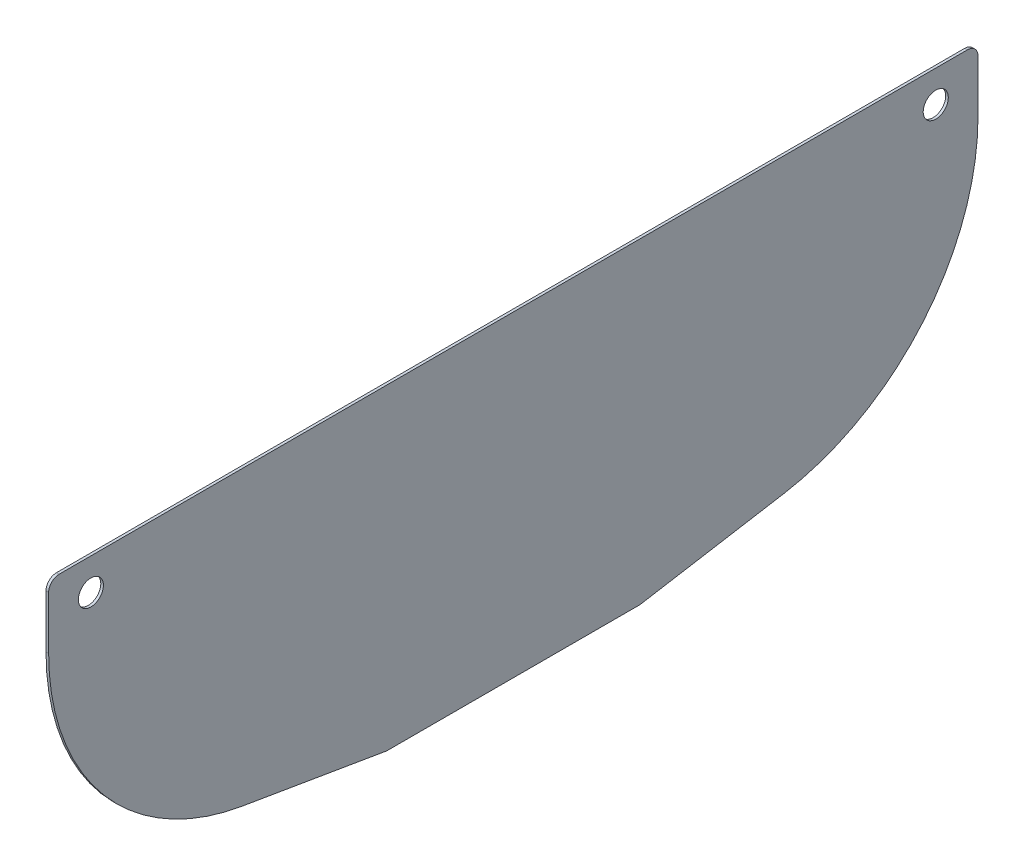
from build123d import *

# Parameters (mm, degrees)
SKETCH1_R           = 15.08125
BOSS_EXTRUDE1_DEPTH = 3.175
FILLET1_R           = 12.7


with BuildPart() as part:
    # Sketch1 → Boss-Extrude1 (new body)
    with BuildSketch(Plane(origin=(0, 0, 0), x_dir=(0, 0, -1), z_dir=(1, 0, 0))):
        with BuildLine():
            Line((-558.8, 609.6), (-558.8, 685.8))
            Line((-558.8, 685.8), (558.8, 685.8))
            Line((558.8, 685.8), (558.8, 609.6))
            ThreePointArc((558.8, 609.6), (492.779998657, 429.230002015), (325.91999876, 334.100000517))
            Line((325.91999876, 334.100000517), (152.4, 304.8))
            Line((152.4, 304.8), (-152.4, 304.8))
            Line((-152.4, 304.8), (-325.91999876, 334.100000517))
            ThreePointArc((-325.91999876, 334.100000517), (-492.779998657, 429.230002015), (-558.8, 609.6))
        make_face()
        with Locations((-508, 647.7)):
            Circle(SKETCH1_R, mode=Mode.SUBTRACT)
        with Locations((508, 647.7)):
            Circle(SKETCH1_R, mode=Mode.SUBTRACT)
    extrude(amount=BOSS_EXTRUDE1_DEPTH)

    # Fillet1
    fillet1_edges = [part.edges().sort_by_distance(p)[0] for p in [
        (1.5875, 685.8, -558.8),
        (1.5875, 685.8, 558.8),
        (1.5875, 304.8, 152.4),
        (1.5875, 304.8, -152.4),
    ]]
    fillet(fillet1_edges, radius=FILLET1_R)


solid = part.part
